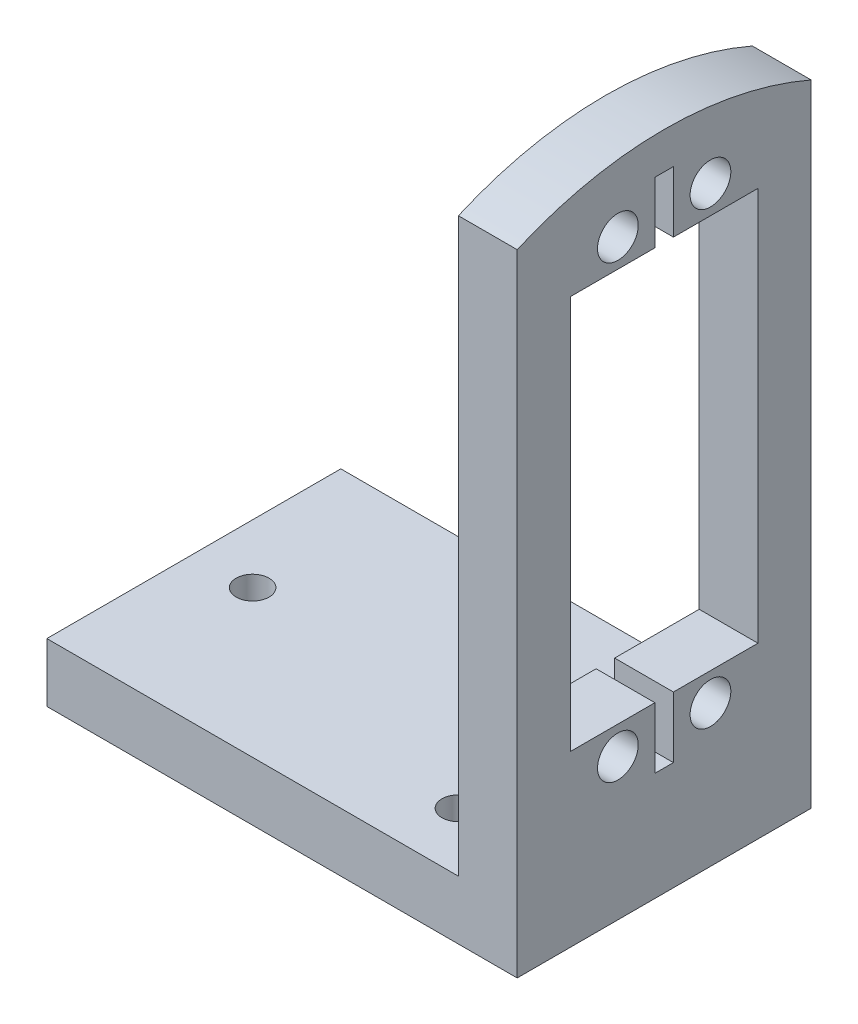
from build123d import *

# Parameters (mm, degrees)
SKETCH3_W           = 31.75
SKETCH3_H           = 67.207500078
SKETCH3_R           = 2.200000045
BOSS_EXTRUDE1_DEPTH = 6.35
SKETCH5_W           = 31.75
SKETCH5_H           = 6.35
BOSS_EXTRUDE2_DEPTH = 50.8
SKETCH6_R           = 1.777000002
CUT_EXTRUDE1_DEPTH  = 87.606657173
CUT_EXTRUDE2_DEPTH  = 91.030831201


with BuildPart() as part:
    # Sketch3 → Boss-Extrude1 (new body)
    with BuildSketch(Plane(origin=(0, 0, 0), x_dir=(0, 0, -1), z_dir=(1, 0, 0))):
        with Locations((15.875, 33.603750039)):
            Rectangle(SKETCH3_W, SKETCH3_H)
        with Locations((10.874999967, 8.935000037)):
            Circle(SKETCH3_R, mode=Mode.SUBTRACT)
        with Locations((20.875000033, 8.935000037)):
            Circle(SKETCH3_R, mode=Mode.SUBTRACT)
        with Locations((10.874999967, 57.535000119)):
            Circle(SKETCH3_R, mode=Mode.SUBTRACT)
        with Locations((20.875000033, 57.535000119)):
            Circle(SKETCH3_R, mode=Mode.SUBTRACT)
        Polygon((5.748000061, 54.507500078), (14.875, 54.507500078), (14.875, 61.111500078), (16.875, 61.111500078), (16.875, 54.507500078), (26.001999939, 54.507500078), (26.001999939, 11.962500078), (16.875, 11.962500078), (16.875, 5.358500078), (14.875, 5.358500078), (14.875, 11.962500078), (5.748000061, 11.962500078), align=None, mode=Mode.SUBTRACT)
    extrude(amount=BOSS_EXTRUDE1_DEPTH)

    # Sketch5 → Boss-Extrude2 (add)
    with BuildSketch(Plane(origin=(6.35, 0, 0), x_dir=(0, 0, -1), z_dir=(1, 0, 0))):
        with Locations((15.875, -3.175)):
            Rectangle(SKETCH5_W, SKETCH5_H)
    extrude(amount=-BOSS_EXTRUDE2_DEPTH)

    # Sketch6 → Cut-Extrude1 (cut, through all)
    with BuildSketch(Plane(origin=(0, 0, 0), x_dir=(1, 0, 0), z_dir=(0, 1, 0))):
        with Locations((-6.35, 6.35)):
            Circle(SKETCH6_R)
        with Locations((-38.1, 15.875)):
            Circle(SKETCH6_R)
        with Locations((-6.35, 25.4)):
            Circle(SKETCH6_R)
    extrude(amount=-CUT_EXTRUDE1_DEPTH, mode=Mode.SUBTRACT)

    # Sketch7 → Cut-Extrude2 (cut, through all)
    with BuildSketch(Plane(origin=(6.35, 0, 0), x_dir=(0, 0, -1), z_dir=(1, 0, 0))):
        with BuildLine():
            Line((0, 61.774194579), (0, 82.748877538))
            Line((0, 82.748877538), (31.75, 82.748877538))
            Line((31.75, 82.748877538), (31.75, 61.774194579))
            ThreePointArc((31.75, 61.774194579), (15.875, 65.0875), (0, 61.774194579))
        make_face()
    extrude(amount=-CUT_EXTRUDE2_DEPTH, mode=Mode.SUBTRACT)


solid = part.part
